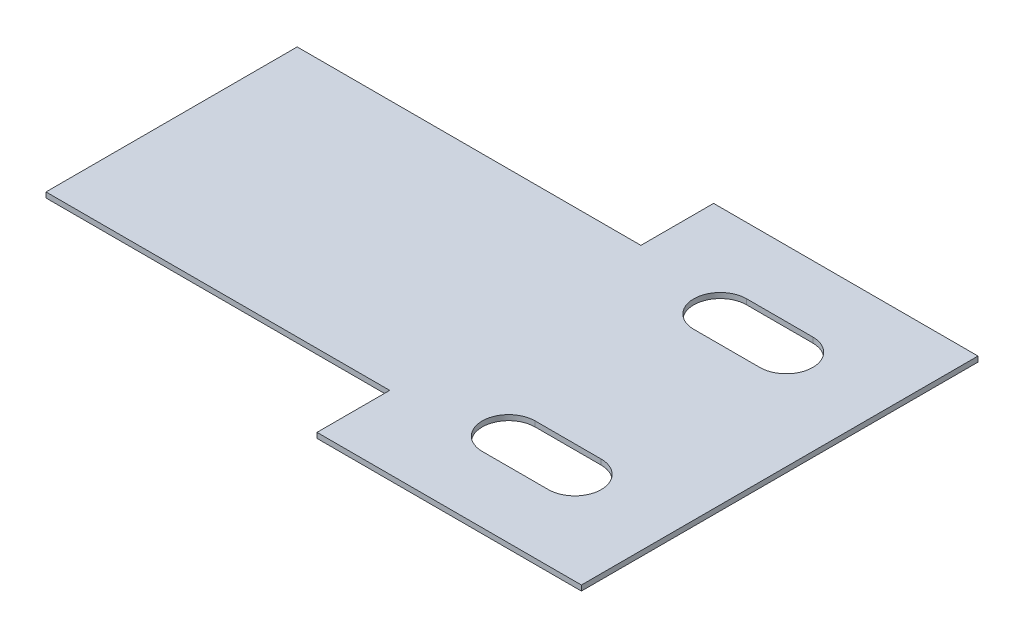
from build123d import *

# Parameters (mm, degrees)
BOSS_EXTRUDE1_DEPTH = 0.1


with BuildPart() as part:
    # Sketch1 → Boss-Extrude1 (new, symmetric)
    with BuildSketch(Plane(origin=(0, 0, 0), x_dir=(1, 0, 0), z_dir=(0, 1, 0))):
        Polygon((-6.778814753, -5.787261175), (6.221185247, -5.787261175), (6.221185247, -8.537261175), (16.221185247, -8.537261175), (16.221185247, 6.462738825), (6.221185247, 6.462738825), (6.221185247, 3.712738825), (-6.778814753, 3.712738825), align=None)
        with BuildLine():
            Line((12.471185247, 3.962738825), (9.971185247, 3.962738825))
            ThreePointArc((9.971185247, 3.962738825), (8.971185247, 2.962738825), (9.971185247, 1.962738825))
            Line((9.971185247, 1.962738825), (12.471185247, 1.962738825))
            ThreePointArc((12.471185247, 1.962738825), (13.471185247, 2.962738825), (12.471185247, 3.962738825))
        make_face(mode=Mode.SUBTRACT)
        with BuildLine():
            Line((12.471185247, -4.037261175), (9.971185247, -4.037261175))
            ThreePointArc((9.971185247, -4.037261175), (8.971185247, -5.037261175), (9.971185247, -6.037261175))
            Line((9.971185247, -6.037261175), (12.471185247, -6.037261175))
            ThreePointArc((12.471185247, -6.037261175), (13.471185247, -5.037261175), (12.471185247, -4.037261175))
        make_face(mode=Mode.SUBTRACT)
    extrude(amount=BOSS_EXTRUDE1_DEPTH, both=True)


solid = part.part
